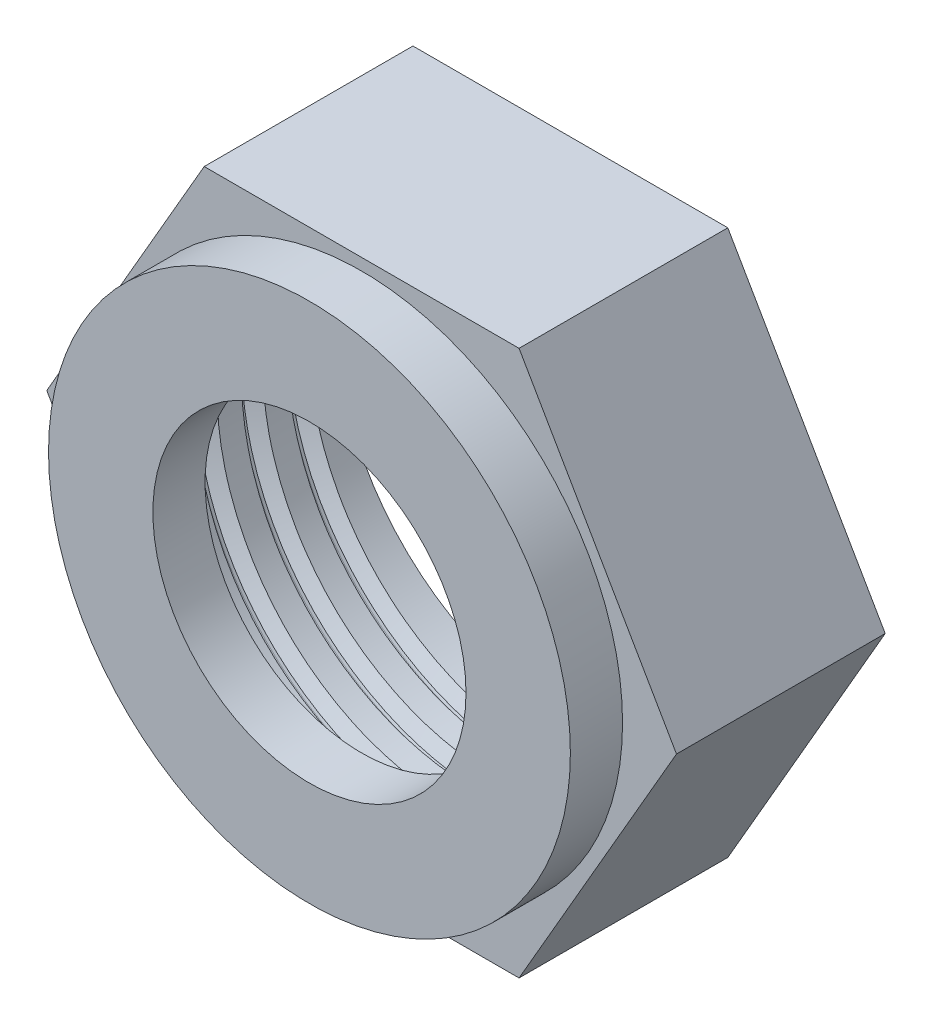
from build123d import *

# Parameters (mm, degrees)
SKETCH1_R           = 10
SKETCH1_R_2         = 6
UPP_CAP_DEPTH       = 2
SKETCH1_3_R         = 9
BOSS_EXTRUDE2_DEPTH = 8
CUT_SWEEP2_PITCH    = 1.75
CUT_SWEEP2_FROM     = 0


with BuildPart() as part:
    # Sketch1 → upp cap (new body)
    with BuildSketch(Plane.XY):
        Circle(SKETCH1_R)
        Circle(SKETCH1_R_2, mode=Mode.SUBTRACT)
    extrude(amount=UPP_CAP_DEPTH)

    # Sketch1<3> → Boss-Extrude2 (add)
    with BuildSketch(Plane.XY):
        Polygon((6.033310313, 10.45), (-6.033310313, 10.45), (-12.066620626, 0), (-6.033310313, -10.45), (6.033310313, -10.45), (12.066620626, 0), align=None)
        Circle(SKETCH1_3_R, mode=Mode.SUBTRACT)
    extrude(amount=-BOSS_EXTRUDE2_DEPTH)

    # Cut-Sweep2: arcs per turn and ends read off the stored shape
    # Cut-Sweep2: the profile of cut profile screwed along a right-hand helix through 5.5 turns, 10 arcs to a turn; built about Z, then put on its axis
    cut_sweep2_z = Axis((0, 0, 0), (0, 0, 1))
    cut_sweep2_corners = [(9.51, 0, -1.75), (9.51, 0, -1.862716595), (8.9997, 0, -2.157338437), (8.9997, 0, -1.342661563), (9.51, 0, -1.637283405)]
    with BuildLine(mode=Mode.PRIVATE) as cut_sweep2_profile:
        Line(cut_sweep2_corners[0], cut_sweep2_corners[1])
        Line(cut_sweep2_corners[1], cut_sweep2_corners[2])
        Line(cut_sweep2_corners[2], cut_sweep2_corners[3])
        Line(cut_sweep2_corners[3], cut_sweep2_corners[4])
        Line(cut_sweep2_corners[4], cut_sweep2_corners[0])
    cut_sweep2_cap = Face(cut_sweep2_profile.wire())
    cut_sweep2_turn_angles = [0, 18, 36, 54, 72, 90, 108, 126, 144, 162, 180, 198, 216, 234, 252, 270, 288, 306, 324, 342, 360]
    cut_sweep2_turn_weights = [1, 0.9510565162951535, 1, 0.9510565162951535, 1, 0.9510565162951535, 1, 0.9510565162951535, 1, 0.9510565162951535, 1, 0.9510565162951535, 1, 0.9510565162951535, 1, 0.9510565162951535, 1, 0.9510565162951535, 1, 0.9510565162951535, 1]
    cut_sweep2_turn_rails = [Edge.make_bspline([Vector(p[0], p[1], 0).rotate(cut_sweep2_z, cut_sweep2_turn_angles[k]) / cut_sweep2_turn_weights[k] + Vector(0, 0, p[2] + CUT_SWEEP2_PITCH * cut_sweep2_turn_angles[k] / 360) for k in range(21)], [0, 0, 0, 1, 1, 2, 2, 3, 3, 4, 4, 5, 5, 6, 6, 7, 7, 8, 8, 9, 9, 10, 10, 10], 2, cut_sweep2_turn_weights) for p in cut_sweep2_corners]
    cut_sweep2_turn_sides = [Face.make_surface_from_curves(cut_sweep2_turn_rails[p[0]], cut_sweep2_turn_rails[p[1]]) for p in [(0, 1), (1, 2), (2, 3), (3, 4), (4, 0)]]
    cut_sweep2_last_angles = [1800, 1818, 1836, 1854, 1872, 1890, 1908, 1926, 1944, 1962, 1980]
    cut_sweep2_last_weights = [1, 0.9510565162951535, 1, 0.9510565162951535, 1, 0.9510565162951535, 1, 0.9510565162951535, 1, 0.9510565162951535, 1]
    cut_sweep2_last_rails = [Edge.make_bspline([Vector(p[0], p[1], 0).rotate(cut_sweep2_z, cut_sweep2_last_angles[k]) / cut_sweep2_last_weights[k] + Vector(0, 0, p[2] + CUT_SWEEP2_PITCH * cut_sweep2_last_angles[k] / 360) for k in range(11)], [0, 0, 0, 1, 1, 2, 2, 3, 3, 4, 4, 5, 5, 5], 2, cut_sweep2_last_weights) for p in cut_sweep2_corners]
    cut_sweep2_last_sides = [Face.make_surface_from_curves(cut_sweep2_last_rails[p[0]], cut_sweep2_last_rails[p[1]]) for p in [(0, 1), (1, 2), (2, 3), (3, 4), (4, 0)]]
    cut_sweep2 = Plane(origin=(0, 0, 0), x_dir=(0, 1, 0), z_dir=(0, 0, -1)) * split(Solid(Shell([*[p.moved(Location((0, 0, CUT_SWEEP2_PITCH * i))) for i in range(5) for p in cut_sweep2_turn_sides], *cut_sweep2_last_sides, cut_sweep2_cap, cut_sweep2_cap.rotate(cut_sweep2_z, 1980).moved(Location((0, 0, CUT_SWEEP2_PITCH * 1980 / 360)))])), bisect_by=Plane.XY.offset(CUT_SWEEP2_FROM), keep=Keep.TOP, mode=Mode.PRIVATE)
    add(cut_sweep2, mode=Mode.SUBTRACT)


solid = part.part
